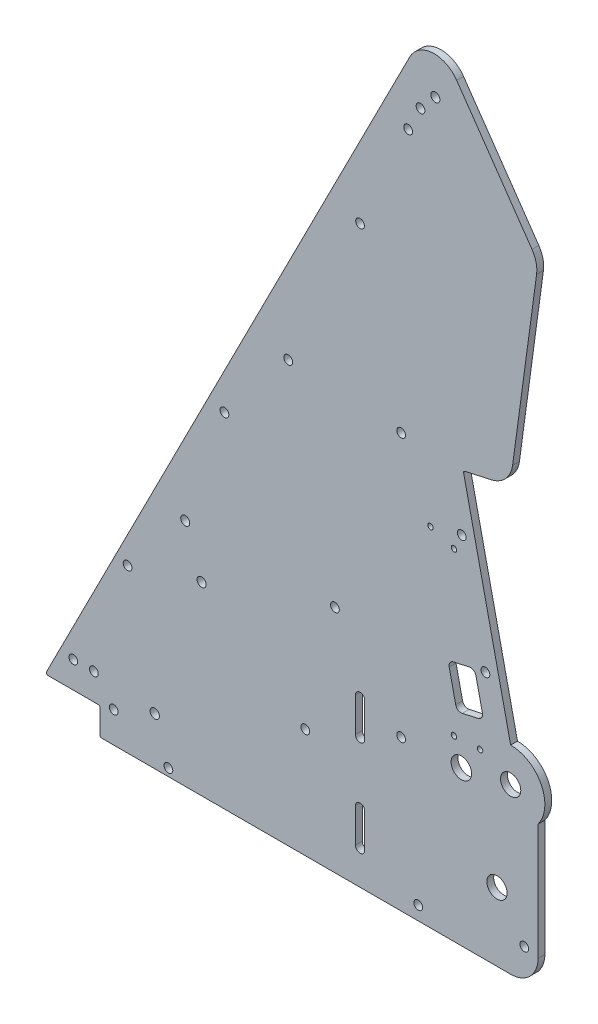
from build123d import *

# Parameters (mm, degrees)
BOSS_EXTRUDE1_DEPTH     = 3.175
SKETCH2_R               = 2.0955
SKETCH2_R_2             = 2.032
SKETCH2_R_3             = 4.699
CUT_EXTRUDE1_DEPTH      = 421.976111717
SKETCH7_R               = 2.159
SKETCH7_R_2             = 2.032
CUT_EXTRUDE2_DEPTH      = 421.976111717
CUT_EXTRUDE3_REACH      = 422.976
SKETCH10_R              = 2.032
FILLET1_R               = 12.7
FILLET2_R               = 0.79375
SKETCH12_R              = 2.032
CUT_EXTRUDE5_DEPTH      = 411.989226146
CUT_EXTRUDE6_DEPTH      = 411.989226146
CUT_EXTRUDE6_DEPTH_BACK = 411.989226146
SKETCH13_R              = 1.27
CUT_EXTRUDE7_REACH      = 412.989
SKETCH14_R              = 2.032
SKETCH15_R              = 2.032
CUT_EXTRUDE8_DEPTH      = 411.989226146
FILLET3_R               = 2.54
SKETCH16_R              = 4.7625
CUT_EXTRUDE9_DEPTH      = 411.989226146


with BuildPart() as part:
    # Sketch1 → Boss-Extrude1 (new body)
    with BuildSketch(Plane.XY):
        with BuildLine():
            Line((228.6, -12.7), (228.6, 53.975))
            ThreePointArc((228.6, 53.975), (230.099031657, 70.599515829), (215.9, 79.375))
            Line((215.9, 79.375), (193.909735224, 178.566674323))
            Line((193.909735224, 178.566674323), (215.607913982, 183.377044743))
            Line((215.607913982, 183.377044743), (228.6, 279.4))
            Line((228.6, 279.4), (178.754725958, 351.413083686))
            Line((178.754725958, 351.413083686), (0, 0))
            Line((0, 0), (25.4, 0))
            Line((25.4, 0), (25.4, -12.7))
            Line((25.4, -12.7), (228.6, -12.7))
        make_face()
    extrude(amount=BOSS_EXTRUDE1_DEPTH)

    # Sketch2 → Cut-Extrude1 (cut, through all)
    with BuildSketch(Plane.XY.offset(3.175)):
        with Locations((64.943150167, 94.057839899)):
            Circle(SKETCH2_R)
        with Locations((180.975, 322.164313376)):
            Circle(SKETCH2_R)
        with Locations((72.544547852, 73.173171402)):
            Circle(SKETCH2_R)
        with Locations((193.207821773, 152.394364194)):
            Circle(SKETCH2_R_2)
        with Locations((215.9, 63.5)):
            Circle(SKETCH2_R_3)
        with Locations((173.0375, -6.35)):
            Circle(SKETCH2_R_2)
        with Locations((204.202954161, 102.798527032)):
            Circle(SKETCH2_R_2)
        with Locations((209.55, 19.05)):
            Circle(SKETCH2_R_3)
        with Locations((165.1, 179.3875)):
            Circle(SKETCH2_R_2)
    extrude(amount=-CUT_EXTRUDE1_DEPTH, mode=Mode.SUBTRACT)

    # Sketch7 → Cut-Extrude2 (cut, through all)
    with BuildSketch(Plane.XY.offset(3.175)):
        with Locations((50.8, 9.525)):
            Circle(SKETCH7_R)
        with Locations((134.393547852, 93.98)):
            Circle(SKETCH7_R_2)
        with BuildLine():
            Line((143.891, 3.175), (143.891, 19.05))
            ThreePointArc((143.891, 19.05), (146.05, 21.209), (148.209, 19.05))
            Line((148.209, 19.05), (148.209, 3.175))
            ThreePointArc((148.209, 3.175), (146.05, 1.016), (143.891, 3.175))
        make_face()
        with BuildLine():
            Line((143.891, 47.625), (143.891, 63.5))
            ThreePointArc((143.891, 63.5), (146.05, 65.659), (148.209, 63.5))
            Line((148.209, 63.5), (148.209, 47.625))
            ThreePointArc((148.209, 47.625), (146.05, 45.466), (143.891, 47.625))
        make_face()
    extrude(amount=-CUT_EXTRUDE2_DEPTH, mode=Mode.SUBTRACT)

    # Sketch10 → Cut-Extrude3 (cut, up to next)
    with BuildSketch(Plane.XY.offset(3.175), mode=Mode.PRIVATE) as cut_extrude3_sk1:
        with Locations((165.1, 57.15)):
            Circle(SKETCH10_R)
    cut_extrude3_tool1 = extrude(cut_extrude3_sk1.sketch, amount=-CUT_EXTRUDE3_REACH, mode=Mode.PRIVATE) & part.part
    # Sketch10 → Cut-Extrude3 (cut, up to next)
    with BuildSketch(Plane.XY.offset(3.175), mode=Mode.PRIVATE) as cut_extrude3_sk2:
        with Locations((120.65, 38.1)):
            Circle(SKETCH10_R)
    cut_extrude3_tool2 = extrude(cut_extrude3_sk2.sketch, amount=-CUT_EXTRUDE3_REACH, mode=Mode.PRIVATE) & part.part
    # Sketch10 → Cut-Extrude3 (cut, up to next)
    with BuildSketch(Plane.XY.offset(3.175), mode=Mode.PRIVATE) as cut_extrude3_sk3:
        with Locations((13.046467246, 12.334704411)):
            Circle(SKETCH10_R)
    cut_extrude3_tool3 = extrude(cut_extrude3_sk3.sketch, amount=-CUT_EXTRUDE3_REACH, mode=Mode.PRIVATE) & part.part
    # Sketch10 → Cut-Extrude3 (cut, up to next)
    with BuildSketch(Plane.XY.offset(3.175), mode=Mode.PRIVATE) as cut_extrude3_sk4:
        with Locations((22.571467246, 12.334704411)):
            Circle(SKETCH10_R)
    cut_extrude3_tool4 = extrude(cut_extrude3_sk4.sketch, amount=-CUT_EXTRUDE3_REACH, mode=Mode.PRIVATE) & part.part
    # Sketch10 → Cut-Extrude3 (cut, up to next)
    with BuildSketch(Plane.XY.offset(3.175), mode=Mode.PRIVATE) as cut_extrude3_sk5:
        with Locations((38.211447917, 62.639810909)):
            Circle(SKETCH10_R)
    cut_extrude3_tool5 = extrude(cut_extrude3_sk5.sketch, amount=-CUT_EXTRUDE3_REACH, mode=Mode.PRIVATE) & part.part
    add(cut_extrude3_tool1.solids().sort_by_distance((165.1, 57.15, 3.175))[0], mode=Mode.SUBTRACT)
    add(cut_extrude3_tool2.solids().sort_by_distance((120.65, 38.1, 3.175))[0], mode=Mode.SUBTRACT)
    add(cut_extrude3_tool3.solids().sort_by_distance((13.046467, 12.334704, 3.175))[0], mode=Mode.SUBTRACT)
    add(cut_extrude3_tool4.solids().sort_by_distance((22.571467, 12.334704, 3.175))[0], mode=Mode.SUBTRACT)
    add(cut_extrude3_tool5.solids().sort_by_distance((38.211448, 62.639811, 3.175))[0], mode=Mode.SUBTRACT)

    # Fillet1
    fillet1_edges = [part.edges().sort_by_distance(p)[0] for p in [
        (228.6, -12.7, 1.5875),
        (178.754725958, 351.413083686, 1.5875),
        (215.607913982, 183.377044743, 1.5875),
        (228.6, 279.4, 1.5875),
    ]]
    fillet(fillet1_edges, radius=FILLET1_R)

    # Fillet2
    fillet2_edges = [part.edges().sort_by_distance(p)[0] for p in [
        (25.4, -12.7, 1.5875),
        (25.4, 0, 1.5875),
        (193.909735224, 178.566674323, 1.5875),
        (0, 0, 1.5875),
    ]]
    fillet(fillet2_edges, radius=FILLET2_R)

    # Sketch12 → Cut-Extrude5 (cut, through all)
    with BuildSketch(Plane.XY.offset(3.175)):
        with Locations((31.75, 1.5875)):
            Circle(SKETCH12_R)
        with Locations((222.25, 1.5875)):
            Circle(SKETCH12_R)
        with Locations((57.15, -9.2075)):
            Circle(SKETCH12_R)
    extrude(amount=-CUT_EXTRUDE5_DEPTH, mode=Mode.SUBTRACT)

    # Sketch13 → Cut-Extrude6 (cut, two sides: drawn at the far end of the back side and taken through both)
    with BuildSketch(Plane.XY.offset(3.175).offset(-CUT_EXTRUDE6_DEPTH_BACK)):
        with Locations((189.602197334, 69.980636704)):
            Circle(SKETCH13_R)
        with Locations((201.708862449, 70.509225118)):
            Circle(SKETCH13_R)
        with Locations((178.721644858, 148.532438598)):
            Circle(SKETCH13_R)
        with Locations((189.622629605, 145.09537131)):
            Circle(SKETCH13_R)
        Polygon((186.844411154, 98.950230697), (199.243370445, 101.699013794), (203.36654509, 83.100574858), (190.9675858, 80.351791761), align=None)
    extrude(amount=CUT_EXTRUDE6_DEPTH + CUT_EXTRUDE6_DEPTH_BACK, mode=Mode.SUBTRACT)

    # Sketch14 → Cut-Extrude7 (cut, up to next)
    with BuildSketch(Plane.XY.offset(3.175), mode=Mode.PRIVATE) as cut_extrude7_sk1:
        with Locations((146.05, 254)):
            Circle(SKETCH14_R)
    cut_extrude7_tool1 = extrude(cut_extrude7_sk1.sketch, amount=-CUT_EXTRUDE7_REACH, mode=Mode.PRIVATE) & part.part
    # Sketch14 → Cut-Extrude7 (cut, up to next)
    with BuildSketch(Plane.XY.offset(3.175), mode=Mode.PRIVATE) as cut_extrude7_sk2:
        with Locations((112.7125, 182.5625)):
            Circle(SKETCH14_R)
    cut_extrude7_tool2 = extrude(cut_extrude7_sk2.sketch, amount=-CUT_EXTRUDE7_REACH, mode=Mode.PRIVATE) & part.part
    add(cut_extrude7_tool1.solids().sort_by_distance((146.05, 254, 3.175))[0], mode=Mode.SUBTRACT)
    add(cut_extrude7_tool2.solids().sort_by_distance((112.7125, 182.5625, 3.175))[0], mode=Mode.SUBTRACT)

    # Sketch15 → Cut-Extrude8 (cut, through all)
    with BuildSketch(Plane.XY.offset(3.175)):
        with Locations((83.136819993, 146.631489078)):
            Circle(SKETCH15_R)
        with Locations((174.099451819, 314.249971331)):
            Circle(SKETCH15_R)
        with Locations((168.341424743, 302.930292705)):
            Circle(SKETCH15_R)
    extrude(amount=-CUT_EXTRUDE8_DEPTH, mode=Mode.SUBTRACT)

    # Fillet3
    fillet3_edges = [part.edges().sort_by_distance(p)[0] for p in [
        (199.243370445, 101.699013794, 1.5875),
        (186.844411154, 98.950230697, 1.5875),
        (190.9675858, 80.351791761, 1.5875),
        (203.36654509, 83.100574858, 1.5875),
    ]]
    fillet(fillet3_edges, radius=FILLET3_R)

    # Sketch16 → Cut-Extrude9 (cut, through all)
    with BuildSketch(Plane.XY.offset(3.175)):
        with Locations((193.04, 58.801)):
            Circle(SKETCH16_R)
    extrude(amount=-CUT_EXTRUDE9_DEPTH, mode=Mode.SUBTRACT)


solid = part.part
